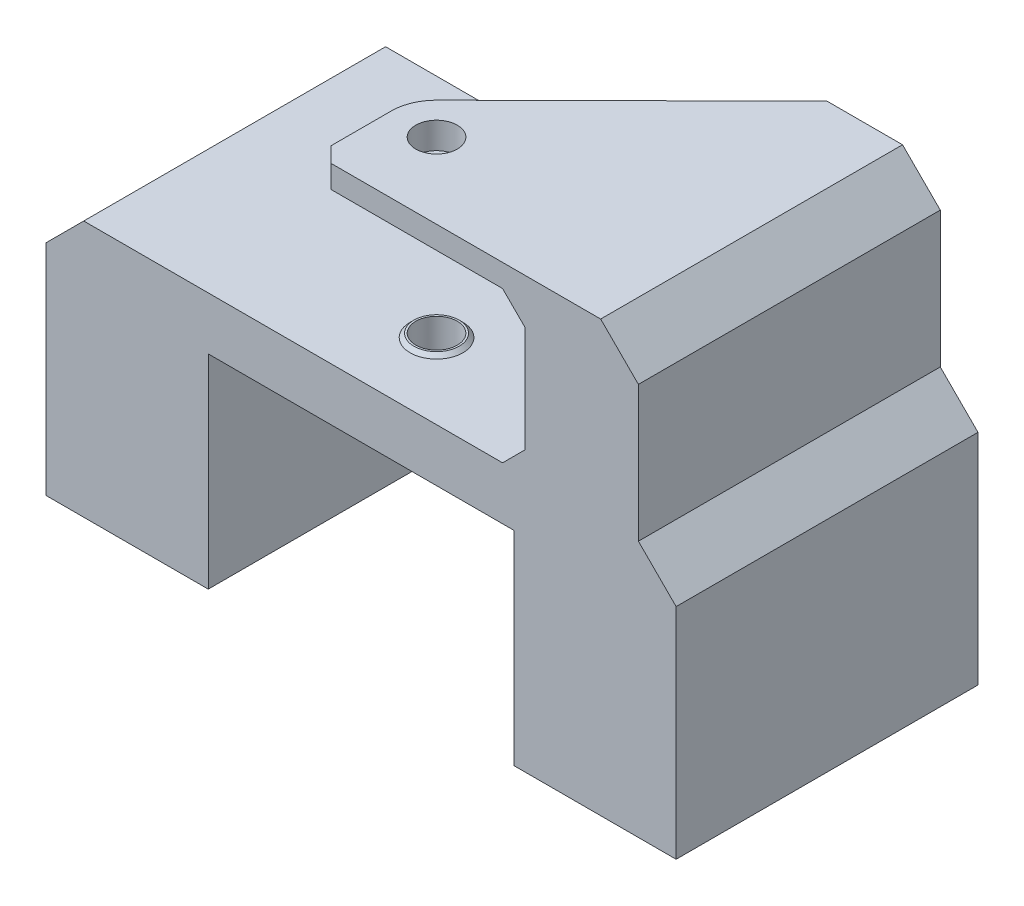
from build123d import *

# Parameters (mm, degrees)
SKETCH1_R           = 4.05
BOSS_EXTRUDE1_DEPTH = 40
SKETCH2_R           = 2.75
CUT_EXTRUDE1_DEPTH  = 40
CHAMFER1_SIZE       = 5
SKETCH4_W           = 15
SKETCH4_H           = 40
BOSS_EXTRUDE2_DEPTH = 20
SKETCH5_R           = 2.75
BOSS_EXTRUDE3_DEPTH = 3
CHAMFER2_SIZE       = 5
CHAMFER3_SIZE       = 5
BOSS_EXTRUDE4_START = -5
SKETCH6_R           = 4.05
BOSS_EXTRUDE4_DEPTH = 5
SKETCH7_R           = 1.95
CUT_EXTRUDE2_DEPTH  = 20
CHAMFER4_SIZE       = 2
CHAMFER5_SIZE       = 3
SKETCH8_R           = 3
SKETCH8_R_2         = 2.75
BOSS_EXTRUDE5_DEPTH = 0.5
CHAMFER6_SIZE       = 0.5
BOSS_EXTRUDE6_START = 0.5
SKETCH9_R           = 3
SKETCH9_R_2         = 2.75
BOSS_EXTRUDE6_DEPTH = 0.5
CHAMFER7_SIZE       = 0.5


with BuildPart() as part:
    # Sketch1 → Boss-Extrude1 (new body)
    with BuildSketch(Plane.XY):
        Polygon((-20.25, 0), (20.25, 0), (20.25, -27), (41.75, -27), (41.75, 7), (-41.75, 7), (-41.75, -27), (-20.25, -27), align=None)
        with Locations((31.75, -10)):
            Circle(SKETCH1_R, mode=Mode.SUBTRACT)
        with Locations(Location((-31.75, -10, 0), (0, 0, 180))):
            Circle(SKETCH1_R, mode=Mode.SUBTRACT)
    extrude(amount=BOSS_EXTRUDE1_DEPTH)

    # Sketch2 → Cut-Extrude1 (cut)
    with BuildSketch(Plane(origin=(0, 0, 0), x_dir=(-1, 0, 0), z_dir=(0, -1, 0))):
        with Locations(Location((0, -30, 0), (0, 0, 90))):
            Circle(SKETCH2_R)
    extrude(amount=-CUT_EXTRUDE1_DEPTH, mode=Mode.SUBTRACT)

    # Chamfer1
    chamfer1_edges = [part.edges().sort_by_distance(p)[0] for p in [
        (41.75, 7, 20),
    ]]
    chamfer(chamfer1_edges, length=CHAMFER1_SIZE)

    # Sketch4 → Boss-Extrude2 (add)
    with BuildSketch(Plane(origin=(0, 7, 0), x_dir=(1, 0, 0), z_dir=(0, 1, 0))):
        with Locations((29.25, -20)):
            Rectangle(SKETCH4_W, SKETCH4_H)
    extrude(amount=BOSS_EXTRUDE2_DEPTH)

    # Sketch5 → Boss-Extrude3 (add)
    with BuildSketch(Plane(origin=(0, 27, 0), x_dir=(1, 0, 0), z_dir=(0, 1, 0))):
        with BuildLine():
            Line((20.579588566, -40), (21.75, -40))
            Line((21.75, -40), (36.75, -40))
            Line((36.75, -40), (36.75, 0))
            Line((36.75, 0), (21.75, 0))
            Line((21.75, 0), (-4.223300645, -25.738107033))
            ThreePointArc((-4.223300645, -25.738107033), (-5.538041345, -27.691299485), (-6, -30))
            Line((-6, -30), (-6, -40))
            Line((-6, -40), (20.579588566, -40))
        make_face()
        with Locations(Location((0, -30, 0), (0, 0, 90))):
            Circle(SKETCH5_R, mode=Mode.SUBTRACT)
    extrude(amount=BOSS_EXTRUDE3_DEPTH)

    # Chamfer2
    chamfer2_edges = [part.edges().sort_by_distance(p)[0] for p in [
        (36.75, 30, 20),
    ]]
    chamfer(chamfer2_edges, length=CHAMFER2_SIZE)

    # Chamfer3
    chamfer3_edges = [part.edges().sort_by_distance(p)[0] for p in [
        (-41.75, 7, 20),
    ]]
    chamfer(chamfer3_edges, length=CHAMFER3_SIZE)

    # Sketch6 → Boss-Extrude4 (add)
    with BuildSketch(Plane.XY.offset(40).offset(BOSS_EXTRUDE4_START)):
        with Locations(Location((-31.75, -10, 0), (0, 0, 180))):
            Circle(SKETCH6_R)
        with Locations((31.75, -10)):
            Circle(SKETCH6_R)
    extrude(amount=BOSS_EXTRUDE4_DEPTH)

    # Sketch7 → Cut-Extrude2 (cut)
    with BuildSketch(Plane(origin=(0, -27, 0), x_dir=(-1, 0, 0), z_dir=(0, -1, 0))):
        with Locations(Location((-31, -5, 0), (0, 0, 90))):
            Circle(SKETCH7_R)
        with Locations(Location((-31, -25, 0), (0, 0, 90))):
            Circle(SKETCH7_R)
    cut_extrude2 = extrude(amount=-CUT_EXTRUDE2_DEPTH, mode=Mode.SUBTRACT)

    # Mirror1: Cut-Extrude2 across plane
    add(cut_extrude2.mirror(Plane(origin=(0, 0, 0), x_dir=(0, 0, 1), z_dir=(1, 0, 0))), mode=Mode.SUBTRACT)

    # Chamfer4
    chamfer4_edges = [part.edges().sort_by_distance(p)[0] for p in [
        (-6, 28.5, 40),
    ]]
    chamfer(chamfer4_edges, length=CHAMFER4_SIZE)

    # Chamfer5
    chamfer5_edges = [part.edges().sort_by_distance(p)[0] for p in [
        (21.75, 7, 20),
        (21.75, 27, 20),
    ]]
    chamfer(chamfer5_edges, length=CHAMFER5_SIZE)

    # Sketch8 → Boss-Extrude5 (add)
    with BuildSketch(Plane(origin=(0, 7, 0), x_dir=(1, 0, 0), z_dir=(0, 1, 0))):
        with Locations(Location((0, -30, 0), (0, 0, 90))):
            Circle(SKETCH8_R)
        with Locations(Location((0, -30, 0), (0, 0, 90))):
            Circle(SKETCH8_R_2, mode=Mode.SUBTRACT)
    extrude(amount=BOSS_EXTRUDE5_DEPTH)

    # Chamfer6
    chamfer6_edges = [part.edges().sort_by_distance(p)[0] for p in [
        (0, 7, 33),
    ]]
    chamfer(chamfer6_edges, length=CHAMFER6_SIZE - 0.0001)  # a hair under: the kernel refuses the full size

    # Sketch9 → Boss-Extrude6 (add)
    with BuildSketch(Plane(origin=(0, 27, 0), x_dir=(-1, 0, 0), z_dir=(0, -1, 0)).offset(BOSS_EXTRUDE6_START)):
        with Locations(Location((0, -30, 0), (0, 0, 270))):
            Circle(SKETCH9_R)
        with Locations(Location((0, -30, 0), (0, 0, 90))):
            Circle(SKETCH9_R_2, mode=Mode.SUBTRACT)
    extrude(amount=-BOSS_EXTRUDE6_DEPTH)

    # Chamfer7
    chamfer7_edges = [part.edges().sort_by_distance(p)[0] for p in [
        (0, 27, 27),
    ]]
    chamfer(chamfer7_edges, length=CHAMFER7_SIZE - 0.0001)  # a hair under: the kernel refuses the full size


solid = part.part
